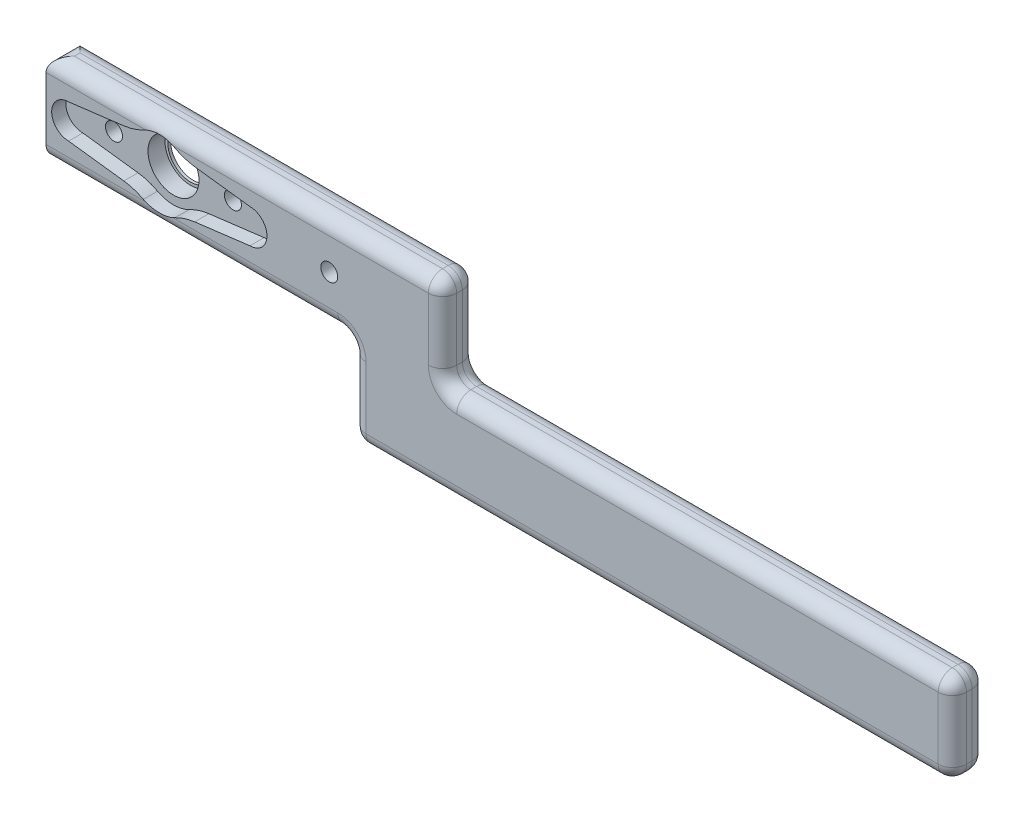
from build123d import *

# Parameters (mm, degrees)
SKETCH_1_R          = 1.5
EXTRUDE_1_DEPTH     = 6
CUT_EXTRUDE_3_DEPTH = 2.5
SKETCH_5_R          = 4.5
CUT_EXTRUDE_4_DEPTH = 3
SKETCH_6_R          = 4
CUT_EXTRUDE_5_DEPTH = 3
SKETCH_7_R          = 1.5
CUT_EXTRUDE_6_DEPTH = 43
FILLET_1_R          = 2.5
FILLET_2_R          = 2.5


with BuildPart() as part:
    # Эскиз1 → Бобышка-Вытянуть1 (new body)
    with BuildSketch(Plane.XY):
        Polygon((0, 0), (0, 16), (70, 16), (70, 0), (160, 0), (160, -16), (54, -16), (54, 0), align=None)
        with Locations((20, 8)):
            Circle(SKETCH_1_R, mode=Mode.SUBTRACT)
        with Locations((30.5, 8)):
            Circle(SKETCH_1_R, mode=Mode.SUBTRACT)
        with Locations(Location((9.5, 8, 0), (0, 0, 180))):
            Circle(SKETCH_1_R, mode=Mode.SUBTRACT)
    extrude(amount=EXTRUDE_1_DEPTH)

    # Эскиз4 → Вырез-Вытянуть3 (cut)
    with BuildSketch(Plane.XY.offset(6)):
        with BuildLine():
            Line((4, 11), (13.746665091, 12.215156208))
            ThreePointArc((13.746665091, 12.215156208), (15.51833306, 12.60172211), (17.191063441, 13.301874707))
            ThreePointArc((17.191063441, 13.301874707), (20, 14), (22.808936559, 13.301874707))
            ThreePointArc((22.808936559, 13.301874707), (24.48166694, 12.60172211), (26.253334909, 12.215156208))
            Line((26.253334909, 12.215156208), (36, 11))
            ThreePointArc((36, 11), (39, 8), (36, 5))
            Line((36, 5), (26.253334909, 3.784843792))
            ThreePointArc((26.253334909, 3.784843792), (24.48166694, 3.39827789), (22.808936559, 2.698125293))
            ThreePointArc((22.808936559, 2.698125293), (20, 2), (17.191063441, 2.698125293))
            ThreePointArc((17.191063441, 2.698125293), (15.51833306, 3.39827789), (13.746665091, 3.784843792))
            Line((13.746665091, 3.784843792), (4, 5))
            ThreePointArc((4, 5), (1, 8), (4, 11))
        make_face()
    extrude(amount=-CUT_EXTRUDE_3_DEPTH, mode=Mode.SUBTRACT)

    # Эскиз5 → Вырез-Вытянуть4 (cut)
    with BuildSketch(Plane.XY.offset(3.5)):
        with Locations((20, 8)):
            Circle(SKETCH_5_R)
    extrude(amount=-CUT_EXTRUDE_4_DEPTH, mode=Mode.SUBTRACT)

    # Эскиз6 → Вырез-Вытянуть5 (cut)
    with BuildSketch(Plane.XY.offset(0.5)):
        with Locations((20, 8)):
            Circle(SKETCH_6_R)
    extrude(amount=-CUT_EXTRUDE_5_DEPTH, mode=Mode.SUBTRACT)

    # Эскиз7 → Вырез-Вытянуть6 (cut)
    with BuildSketch(Plane.XY.offset(6)):
        with Locations((50, 8)):
            Circle(SKETCH_7_R)
        with Locations((80, 8)):
            Circle(SKETCH_7_R)
        with Locations((110, 8)):
            Circle(SKETCH_7_R)
        with Locations((140, 8)):
            Circle(SKETCH_7_R)
        with Locations((170, 8)):
            Circle(SKETCH_7_R)
    extrude(amount=-CUT_EXTRUDE_6_DEPTH, mode=Mode.SUBTRACT)

    # Скругление1
    # the kernel refuses this fillet: 2.5 mm, written as the material it adds along each edge
    with BuildSketch(Plane(origin=(70, 0, 0), x_dir=(0, 1, 0), z_dir=(0, 0, 1))) as fillet_1_piece_1:
        with BuildLine():
            CenterArc((FILLET_1_R, -FILLET_1_R), FILLET_1_R, 90, 90)
            Line((0, -FILLET_1_R), (0, 0))
            Line((0, 0), (FILLET_1_R, 0))
        make_face()
    extrude(amount=6)
    with BuildSketch(Plane(origin=(54, 0, 0), x_dir=(-1, 0, 0), z_dir=(0, 0, 1))) as fillet_1_piece_2:
        with BuildLine():
            CenterArc((FILLET_1_R, FILLET_1_R), FILLET_1_R, 180, 90)
            Line((0, FILLET_1_R), (0, 0))
            Line((0, 0), (FILLET_1_R, 0))
        make_face()
    extrude(amount=6)
    # the kernel refuses this fillet: 2.5 mm, written as the material it takes off along each edge
    with BuildSketch(Plane(origin=(56.5, -13.5, 2.5), x_dir=(0, 0, -1), z_dir=(0, -1, 0))) as fillet_1_2_piece_1_section:
        Polygon((0, 0), (FILLET_1_R, 0), (FILLET_1_R, -FILLET_1_R), (0, -FILLET_1_R), align=None)
    fillet_1_2_piece_1 = extrude(amount=FILLET_1_R, mode=Mode.PRIVATE)
    fillet_1_2_piece_1 = fillet_1_2_piece_1 - Plane(origin=(56.5, -13.5, 2.5), x_dir=(0.7071067811865475, 0, 0.7071067811865475), z_dir=(0, -1, 0)) * Sphere(FILLET_1_R, mode=Mode.PRIVATE)
    add(fillet_1_2_piece_1, mode=Mode.SUBTRACT)
    with BuildSketch(Plane(origin=(56.5, -13.5, 3.5), x_dir=(0, 0, 1), z_dir=(0, -1, 0))) as fillet_1_2_piece_2_section:
        Polygon((0, 0), (FILLET_1_R, 0), (FILLET_1_R, FILLET_1_R), (0, FILLET_1_R), align=None)
    fillet_1_2_piece_2 = extrude(amount=FILLET_1_R, mode=Mode.PRIVATE)
    fillet_1_2_piece_2 = fillet_1_2_piece_2 - Plane(origin=(56.5, -13.5, 3.5), x_dir=(0.7071067811865475, 0, -0.7071067811865475), z_dir=(0, -1, 0)) * Sphere(FILLET_1_R, mode=Mode.PRIVATE)
    add(fillet_1_2_piece_2, mode=Mode.SUBTRACT)
    with BuildSketch(Plane(origin=(67.5, 13.5, 2.5), x_dir=(0, 0, -1), z_dir=(0, 1, 0))) as fillet_1_2_piece_3_section:
        Polygon((0, 0), (FILLET_1_R, 0), (FILLET_1_R, -FILLET_1_R), (0, -FILLET_1_R), align=None)
    fillet_1_2_piece_3 = extrude(amount=FILLET_1_R, mode=Mode.PRIVATE)
    fillet_1_2_piece_3 = fillet_1_2_piece_3 - Plane(origin=(67.5, 13.5, 2.5), x_dir=(-0.7071067811865475, 0, 0.7071067811865475), z_dir=(0, 1, 0)) * Sphere(FILLET_1_R, mode=Mode.PRIVATE)
    add(fillet_1_2_piece_3, mode=Mode.SUBTRACT)
    with BuildSketch(Plane(origin=(67.5, 13.5, 3.5), x_dir=(0, 0, 1), z_dir=(0, 1, 0))) as fillet_1_2_piece_4_section:
        Polygon((0, 0), (FILLET_1_R, 0), (FILLET_1_R, FILLET_1_R), (0, FILLET_1_R), align=None)
    fillet_1_2_piece_4 = extrude(amount=FILLET_1_R, mode=Mode.PRIVATE)
    fillet_1_2_piece_4 = fillet_1_2_piece_4 - Plane(origin=(67.5, 13.5, 3.5), x_dir=(-0.7071067811865475, 0, -0.7071067811865475), z_dir=(0, 1, 0)) * Sphere(FILLET_1_R, mode=Mode.PRIVATE)
    add(fillet_1_2_piece_4, mode=Mode.SUBTRACT)
    with BuildSketch(Plane(origin=(166.25, -16, 0), x_dir=(0, 1, 0), z_dir=(-1, 0, 0))) as fillet_1_2_piece_5:
        with BuildLine():
            CenterArc((FILLET_1_R, -FILLET_1_R), FILLET_1_R, 90, 90)
            Line((0, -FILLET_1_R), (0, 0))
            Line((0, 0), (FILLET_1_R, 0))
        make_face()
    extrude(amount=109.75, mode=Mode.SUBTRACT)
    with BuildSketch(Plane(origin=(54, -13.5, 0), x_dir=(1, 0, 0), z_dir=(0, 1, 0)), Plane(origin=(70, 13.5, 0), x_dir=(-1, 0, 0), z_dir=(0, -1, 0))) as fillet_1_2_piece_6:
        with BuildLine():
            CenterArc((FILLET_1_R, -FILLET_1_R), FILLET_1_R, 90, 90)
            Line((0, -FILLET_1_R), (0, 0))
            Line((0, 0), (FILLET_1_R, 0))
        make_face()
    extrude(amount=11, mode=Mode.SUBTRACT)
    with BuildSketch(Plane(origin=(51.5, 0, 0), x_dir=(0, 0, 1), z_dir=(-1, 0, 0))) as fillet_1_2_piece_7:
        with BuildLine():
            CenterArc((FILLET_1_R, FILLET_1_R), FILLET_1_R, 180, 90)
            Line((0, FILLET_1_R), (0, 0))
            Line((0, 0), (FILLET_1_R, 0))
        make_face()
    extrude(amount=57.75, mode=Mode.SUBTRACT)
    with BuildSketch(Plane(origin=(166.25, -16, 6), x_dir=(0, 1, 0), z_dir=(-1, 0, 0))) as fillet_1_2_piece_8:
        with BuildLine():
            CenterArc((FILLET_1_R, FILLET_1_R), FILLET_1_R, 180, 90)
            Line((0, FILLET_1_R), (0, 0))
            Line((0, 0), (FILLET_1_R, 0))
        make_face()
    extrude(amount=109.75, mode=Mode.SUBTRACT)
    with BuildSketch(Plane(origin=(0, 16, -6.25), x_dir=(0, -1, 0), z_dir=(0, 0, 1)), Plane(origin=(160, 0, -6.25), x_dir=(-1, 0, 0), z_dir=(0, 0, 1))) as fillet_1_2_piece_9:
        with BuildLine():
            CenterArc((FILLET_1_R, FILLET_1_R), FILLET_1_R, 180, 90)
            Line((0, FILLET_1_R), (0, 0))
            Line((0, 0), (FILLET_1_R, 0))
        make_face()
    extrude(amount=18.5, mode=Mode.SUBTRACT)
    with BuildSketch(Plane(origin=(70, 16, 2.5), x_dir=(-1, 0, 0), z_dir=(0, 0, 1))) as fillet_1_2_piece_10:
        with BuildLine():
            CenterArc((FILLET_1_R, FILLET_1_R), FILLET_1_R, 180, 90)
            Line((0, FILLET_1_R), (0, 0))
            Line((0, 0), (FILLET_1_R, 0))
        make_face()
    extrude(amount=1, mode=Mode.SUBTRACT)
    with BuildSketch(Plane(origin=(160, -16, -6.25), x_dir=(-1, 0, 0), z_dir=(0, 0, 1))) as fillet_1_2_piece_11:
        with BuildLine():
            CenterArc((FILLET_1_R, -FILLET_1_R), FILLET_1_R, 90, 90)
            Line((0, -FILLET_1_R), (0, 0))
            Line((0, 0), (FILLET_1_R, 0))
        make_face()
    extrude(amount=18.5, mode=Mode.SUBTRACT)
    with BuildSketch(Plane(origin=(54, -16, 2.5), x_dir=(0, 1, 0), z_dir=(0, 0, 1))) as fillet_1_2_piece_12:
        with BuildLine():
            CenterArc((FILLET_1_R, -FILLET_1_R), FILLET_1_R, 90, 90)
            Line((0, -FILLET_1_R), (0, 0))
            Line((0, 0), (FILLET_1_R, 0))
        make_face()
    extrude(amount=1, mode=Mode.SUBTRACT)
    with BuildSketch(Plane(origin=(72.5, 0, 6), x_dir=(0, -1, 0), z_dir=(1, 0, 0))) as fillet_1_2_piece_13:
        with BuildLine():
            CenterArc((FILLET_1_R, FILLET_1_R), FILLET_1_R, 180, 90)
            Line((0, FILLET_1_R), (0, 0))
            Line((0, 0), (FILLET_1_R, 0))
        make_face()
    extrude(amount=93.75, mode=Mode.SUBTRACT)
    with BuildSketch(Plane(origin=(70, 13.5, 6), x_dir=(-1, 0, 0), z_dir=(0, -1, 0)), Plane(origin=(54, -13.5, 6), x_dir=(1, 0, 0), z_dir=(0, 1, 0))) as fillet_1_2_piece_14:
        with BuildLine():
            CenterArc((FILLET_1_R, FILLET_1_R), FILLET_1_R, 180, 90)
            Line((0, FILLET_1_R), (0, 0))
            Line((0, 0), (FILLET_1_R, 0))
        make_face()
    extrude(amount=11, mode=Mode.SUBTRACT)
    with BuildSketch(Plane(origin=(-6.25, 16, 6), x_dir=(0, 0, -1), z_dir=(1, 0, 0))) as fillet_1_2_piece_15:
        with BuildLine():
            CenterArc((FILLET_1_R, -FILLET_1_R), FILLET_1_R, 90, 90)
            Line((0, -FILLET_1_R), (0, 0))
            Line((0, 0), (FILLET_1_R, 0))
        make_face()
    extrude(amount=73.75, mode=Mode.SUBTRACT)
    with BuildSketch(Plane(origin=(51.5, 0, 6), x_dir=(0, 0, -1), z_dir=(-1, 0, 0))) as fillet_1_2_piece_16:
        with BuildLine():
            CenterArc((FILLET_1_R, -FILLET_1_R), FILLET_1_R, 90, 90)
            Line((0, -FILLET_1_R), (0, 0))
            Line((0, 0), (FILLET_1_R, 0))
        make_face()
    extrude(amount=57.75, mode=Mode.SUBTRACT)
    with BuildSketch(Plane(origin=(-6.25, 16, 0), x_dir=(0, 0, 1), z_dir=(1, 0, 0))) as fillet_1_2_piece_17:
        with BuildLine():
            CenterArc((FILLET_1_R, FILLET_1_R), FILLET_1_R, 180, 90)
            Line((0, FILLET_1_R), (0, 0))
            Line((0, 0), (FILLET_1_R, 0))
        make_face()
    extrude(amount=73.75, mode=Mode.SUBTRACT)
    with BuildSketch(Plane(origin=(72.5, 0, 0), x_dir=(0, -1, 0), z_dir=(1, 0, 0))) as fillet_1_2_piece_18:
        with BuildLine():
            CenterArc((FILLET_1_R, -FILLET_1_R), FILLET_1_R, 90, 90)
            Line((0, -FILLET_1_R), (0, 0))
            Line((0, 0), (FILLET_1_R, 0))
        make_face()
    extrude(amount=93.75, mode=Mode.SUBTRACT)
    with BuildSketch(Plane(origin=(72.5, 2.5, 0), x_dir=(-1, 0, 0), z_dir=(0, 1, 0))) as fillet_1_2_piece_19:
        with BuildLine():
            CenterArc((2.5 + FILLET_1_R, FILLET_1_R), FILLET_1_R, 180, 90)
            Line((2.5, FILLET_1_R), (2.5, 0))
            Line((2.5, 0), (2.5 + FILLET_1_R, 0))
        make_face()
    revolve(axis=Axis((72.5, 2.5, 0), (0, 0, 1)), revolution_arc=90, mode=Mode.SUBTRACT)
    with BuildSketch(Plane(origin=(51.5, -2.5, 6), x_dir=(0, 1, 0), z_dir=(-1, 0, 0))) as fillet_1_2_piece_20:
        with BuildLine():
            CenterArc((2.5 + FILLET_1_R, FILLET_1_R), FILLET_1_R, 180, 90)
            Line((2.5, FILLET_1_R), (2.5, 0))
            Line((2.5, 0), (2.5 + FILLET_1_R, 0))
        make_face()
    revolve(axis=Axis((51.5, -2.5, 6), (0, 0, -1)), revolution_arc=90, mode=Mode.SUBTRACT)
    with BuildSketch(Plane(origin=(72.5, 2.5, 6), x_dir=(-1, 0, 0), z_dir=(0, 1, 0))) as fillet_1_2_piece_21:
        with BuildLine():
            CenterArc((2.5 + FILLET_1_R, -FILLET_1_R), FILLET_1_R, 90, 90)
            Line((2.5, -FILLET_1_R), (2.5, 0))
            Line((2.5, 0), (2.5 + FILLET_1_R, 0))
        make_face()
    revolve(axis=Axis((72.5, 2.5, 6), (0, 0, 1)), revolution_arc=90, mode=Mode.SUBTRACT)
    with BuildSketch(Plane(origin=(51.5, -2.5, 0), x_dir=(0, 1, 0), z_dir=(-1, 0, 0))) as fillet_1_2_piece_22:
        with BuildLine():
            CenterArc((2.5 + FILLET_1_R, -FILLET_1_R), FILLET_1_R, 90, 90)
            Line((2.5, -FILLET_1_R), (2.5, 0))
            Line((2.5, 0), (2.5 + FILLET_1_R, 0))
        make_face()
    revolve(axis=Axis((51.5, -2.5, 0), (0, 0, -1)), revolution_arc=90, mode=Mode.SUBTRACT)

    # Скругление2
    # the kernel refuses this fillet: 2.5 mm, written as the material it takes off along each edge
    with BuildSketch(Plane(origin=(157.5, -13.5, 2.5), x_dir=(1, 0, 0), z_dir=(0, 0, -1))) as fillet_2_piece_1_section:
        Polygon((0, 0), (FILLET_2_R, 0), (FILLET_2_R, FILLET_2_R), (0, FILLET_2_R), align=None)
    fillet_2_piece_1 = extrude(amount=FILLET_2_R, mode=Mode.PRIVATE)
    fillet_2_piece_1 = fillet_2_piece_1 - Plane(origin=(157.5, -13.5, 2.5), x_dir=(-0.707106781186548, 0.707106781186547, 0), z_dir=(0, 0, -1)) * Sphere(FILLET_2_R, mode=Mode.PRIVATE)
    add(fillet_2_piece_1, mode=Mode.SUBTRACT)
    with BuildSketch(Plane(origin=(157.5, -13.5, 3.5), x_dir=(1, 0, 0), z_dir=(0, 0, 1))) as fillet_2_piece_2_section:
        Polygon((0, 0), (FILLET_2_R, 0), (FILLET_2_R, -FILLET_2_R), (0, -FILLET_2_R), align=None)
    fillet_2_piece_2 = extrude(amount=FILLET_2_R, mode=Mode.PRIVATE)
    fillet_2_piece_2 = fillet_2_piece_2 - Plane(origin=(157.5, -13.5, 3.5), x_dir=(-0.707106781186548, 0.707106781186547, 0), z_dir=(0, 0, 1)) * Sphere(FILLET_2_R, mode=Mode.PRIVATE)
    add(fillet_2_piece_2, mode=Mode.SUBTRACT)
    with BuildSketch(Plane(origin=(157.5, -2.5, 2.5), x_dir=(1, 0, 0), z_dir=(0, 0, -1))) as fillet_2_piece_3_section:
        Polygon((0, 0), (FILLET_2_R, 0), (FILLET_2_R, -FILLET_2_R), (0, -FILLET_2_R), align=None)
    fillet_2_piece_3 = extrude(amount=FILLET_2_R, mode=Mode.PRIVATE)
    fillet_2_piece_3 = fillet_2_piece_3 - Plane(origin=(157.5, -2.5, 2.5), x_dir=(-0.707106781186547, -0.7071067811865479, 0), z_dir=(0, 0, -1)) * Sphere(FILLET_2_R, mode=Mode.PRIVATE)
    add(fillet_2_piece_3, mode=Mode.SUBTRACT)
    with BuildSketch(Plane(origin=(157.5, -2.5, 3.5), x_dir=(1, 0, 0), z_dir=(0, 0, 1))) as fillet_2_piece_4_section:
        Polygon((0, 0), (FILLET_2_R, 0), (FILLET_2_R, FILLET_2_R), (0, FILLET_2_R), align=None)
    fillet_2_piece_4 = extrude(amount=FILLET_2_R, mode=Mode.PRIVATE)
    fillet_2_piece_4 = fillet_2_piece_4 - Plane(origin=(157.5, -2.5, 3.5), x_dir=(-0.707106781186547, -0.7071067811865479, 0), z_dir=(0, 0, 1)) * Sphere(FILLET_2_R, mode=Mode.PRIVATE)
    add(fillet_2_piece_4, mode=Mode.SUBTRACT)
    with BuildSketch(Plane(origin=(160, -2.5, 6), x_dir=(-1, 0, 0), z_dir=(0, -1, 0))) as fillet_2_piece_5:
        with BuildLine():
            CenterArc((FILLET_2_R, FILLET_2_R), FILLET_2_R, 180, 90)
            Line((0, FILLET_2_R), (0, 0))
            Line((0, 0), (FILLET_2_R, 0))
        make_face()
    extrude(amount=11, mode=Mode.SUBTRACT)
    with BuildSketch(Plane(origin=(160, -2.5, 0), x_dir=(-1, 0, 0), z_dir=(0, -1, 0))) as fillet_2_piece_6:
        with BuildLine():
            CenterArc((FILLET_2_R, -FILLET_2_R), FILLET_2_R, 90, 90)
            Line((0, -FILLET_2_R), (0, 0))
            Line((0, 0), (FILLET_2_R, 0))
        make_face()
    extrude(amount=11, mode=Mode.SUBTRACT)


solid = part.part
